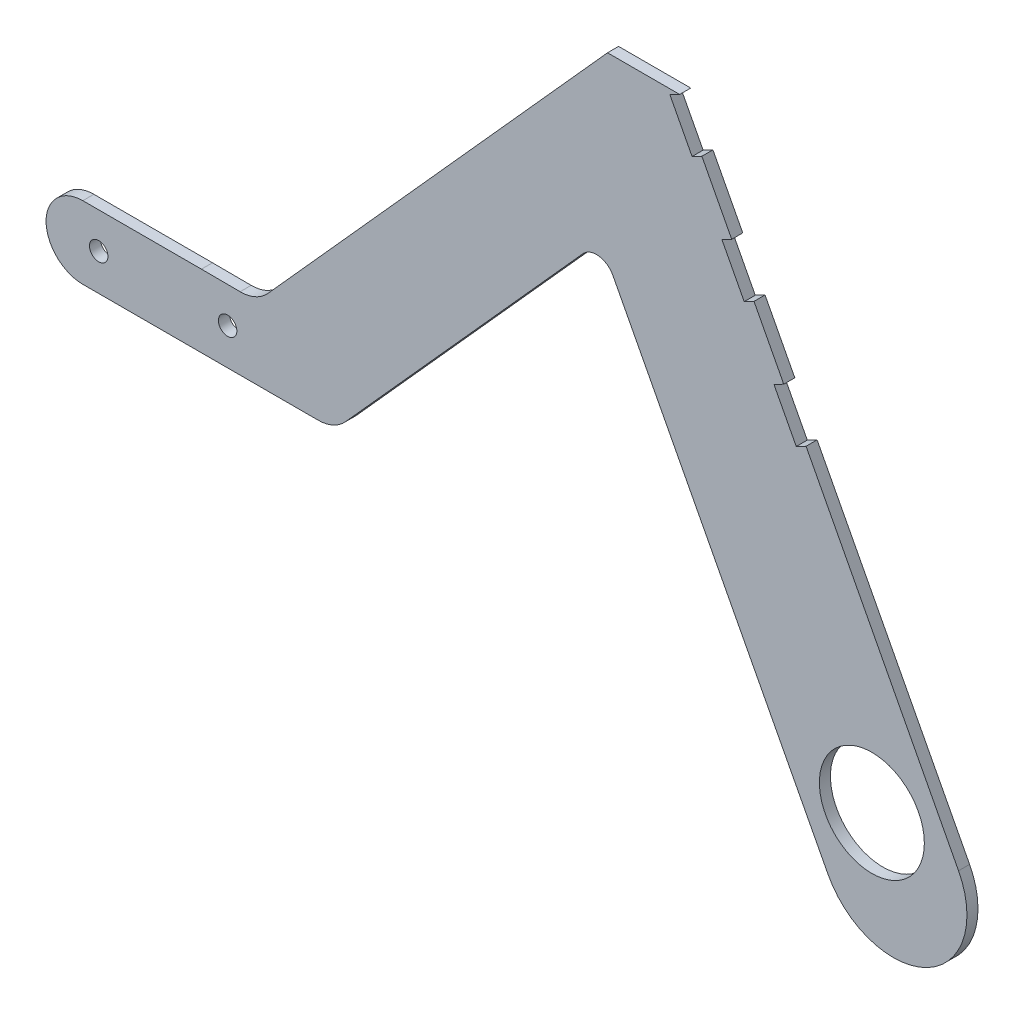
from build123d import *

# Parameters (mm, degrees)
CROQUIS1_R              = 2.5
CROQUIS1_R_2            = 14.25
SALIENTE_EXTRUIR1_DEPTH = 3
CROQUIS3_W              = 3
CROQUIS3_H              = 13.002457907
CROQUIS3_H_2            = 13.048194377
CROQUIS3_H_3            = 13.048194378
CORTAR_EXTRUIR1_DEPTH   = 3
CROQUIS4_W              = 163.675423661
CROQUIS4_H              = 10
CORTAR_EXTRUIR2_DEPTH   = 10
REDONDEO1_R             = 10
CROQUIS5_R              = 2.5
CORTAR_EXTRUIR3_DEPTH   = 10
CORTAR_EXTRUIR4_DEPTH   = 10
CORTAR_EXTRUIR5_DEPTH   = 10
REDONDEO2_R             = 10


with BuildPart() as part:
    # Croquis1 → Saliente-Extruir1 (new body)
    with BuildSketch(Plane.XY):
        with BuildLine():
            Line((-135.811178416, 31.660861846), (-65.873242367, 31.660861846))
            ThreePointArc((-65.873242367, 31.660861846), (-63.837291884, 32.094144685), (-62.154198363, 33.318899594))
            Line((-62.154198363, 33.318899594), (39.377470593, 146.306634388))
            ThreePointArc((39.377470593, 146.306634388), (43.719655801, 147.925689677), (47.526539972, 145.28304984))
            Line((47.526539972, 145.28304984), (132.635412267, -17.345525839))
            ThreePointArc((132.635412267, -17.345525839), (124.188821584, -44.339138154), (97.195209269, -35.892547471))
            Line((97.195209269, -35.892547471), (38.788084081, 75.713532162))
            ThreePointArc((38.788084081, 75.713532162), (34.981199909, 78.356171999), (30.639014702, 76.737116711))
            Line((30.639014702, 76.737116711), (-44.321252629, -6.681100406))
            ThreePointArc((-44.321252629, -6.681100406), (-46.00434615, -7.905855315), (-48.040296633, -8.339138154))
            Line((-48.040296633, -8.339138154), (-135.811178416, -8.339138154))
            ThreePointArc((-135.811178416, -8.339138154), (-155.811178416, 11.660861846), (-135.811178416, 31.660861846))
        make_face()
        with Locations((-135.811178416, 11.660861846)):
            Circle(CROQUIS1_R, mode=Mode.SUBTRACT)
        with Locations((-65.81121578, 11.5885363)):
            Circle(CROQUIS1_R, mode=Mode.SUBTRACT)
        with Locations((109.098617172, -15.504324767)):
            Circle(CROQUIS1_R_2, mode=Mode.SUBTRACT)
    extrude(amount=SALIENTE_EXTRUIR1_DEPTH)

    # Croquis3 → Cortar-Extruir1 (cut)
    with BuildSketch(Plane(origin=(96.993591322, 50.759930368, 0), x_dir=(0, 0, -1), z_dir=(0.8860050749641628, 0.46367554080169926, 0))):
        with Locations((-1.5, 79.927636726)):
            Rectangle(CROQUIS3_W, CROQUIS3_H)
        with Locations((-1.5, 49.42886568)):
            Rectangle(CROQUIS3_W, CROQUIS3_H_2)
        with Locations((-1.5, 18.952962868)):
            Rectangle(CROQUIS3_W, CROQUIS3_H_3)
    extrude(amount=-CORTAR_EXTRUIR1_DEPTH, mode=Mode.SUBTRACT)

    # Croquis4 → Cortar-Extruir2 (cut)
    with BuildSketch(Plane.XY.offset(3)):
        with Locations((-95.362453556, -3.339138154)):
            Rectangle(CROQUIS4_W, CROQUIS4_H)
    extrude(amount=-CORTAR_EXTRUIR2_DEPTH, mode=Mode.SUBTRACT)

    # Redondeo1
    redondeo1_edges = [part.edges().sort_by_distance(p)[0] for p in [
        (-153.131686492, 1.660861846, 1.5),
        (-36.825099605, 1.660861846, 1.5),
    ]]
    fillet(redondeo1_edges, radius=REDONDEO1_R)

    # Croquis5 → Cortar-Extruir3 (cut)
    with BuildSketch(Plane.XY.offset(3)):
        Polygon((-63.64412415, 31.660861846), (-72.924071867, 21.333834995), (-57.92427468, 21.255832735), (-48.581088821, 31.660861846), align=None)
        Polygon((-62.154198363, 33.318899594), (-63.64412415, 31.660861846), (-48.581088821, 31.660861846), (37.330618128, 127.336343983), (22.330618128, 127.336343983), align=None)
        with Locations((-100.811197098, 11.624699073)):
            Circle(CROQUIS5_R)
    extrude(amount=-CORTAR_EXTRUIR3_DEPTH, mode=Mode.SUBTRACT)

    # Croquis6 → Cortar-Extruir4 (cut)
    with BuildSketch(Plane.XY.offset(3)):
        Polygon((-72.924071867, 21.333834995), (-60.713701646, 34.921931069), (-169.534972591, 34.921931069), (-169.534972591, 0), (-115.124337118, 0), (-115.124337118, 21.333834995), align=None)
    extrude(amount=-CORTAR_EXTRUIR4_DEPTH, mode=Mode.SUBTRACT)

    # Croquis7 → Cortar-Extruir5 (cut)
    with BuildSketch(Plane.XY.offset(3)):
        Polygon((22.330618128, 127.336343983), (78.839367292, 127.336343983), (43.163788292, 161.798984153), align=None)
    extrude(amount=-CORTAR_EXTRUIR5_DEPTH, mode=Mode.SUBTRACT)

    # Redondeo2
    # the kernel refuses this fillet: 10 mm, written as the material it adds along each edge
    with BuildSketch(Plane(origin=(-57.92427468, 21.255832735, 3), x_dir=(0.6681211936204373, 0.744052464974885, 0), z_dir=(0, 0, -1))) as redondeo2_piece_1:
        with BuildLine():
            CenterArc((REDONDEO2_R * 0.449163221223, -REDONDEO2_R), REDONDEO2_R, 90, 48.37572531)
            Line((-REDONDEO2_R * 0.298353514379, -REDONDEO2_R * 0.335757024882), (0, 0))
            Line((0, 0), (REDONDEO2_R * 0.449163221223, 0))
        make_face()
    extrude(amount=3)
    # the kernel refuses this fillet: 10 mm, written as the material it takes off along each edge
    with BuildSketch(Plane(origin=(-115.124337118, 1.660861846, 28), x_dir=(1, 0, 0), z_dir=(0, 0, -1))) as redondeo2_2_piece_1:
        with BuildLine():
            CenterArc((REDONDEO2_R, -REDONDEO2_R), REDONDEO2_R, 90, 90)
            Line((0, -REDONDEO2_R), (0, 0))
            Line((0, 0), (REDONDEO2_R, 0))
        make_face()
    extrude(amount=53, mode=Mode.SUBTRACT)
    with BuildSketch(Plane(origin=(-115.124337118, 21.333834995, 28), x_dir=(1, 0, 0), z_dir=(0, 0, -1))) as redondeo2_2_piece_2:
        with BuildLine():
            CenterArc((REDONDEO2_R, REDONDEO2_R), REDONDEO2_R, 180, 90)
            Line((0, REDONDEO2_R), (0, 0))
            Line((0, 0), (REDONDEO2_R, 0))
        make_face()
    extrude(amount=53, mode=Mode.SUBTRACT)


solid = part.part
